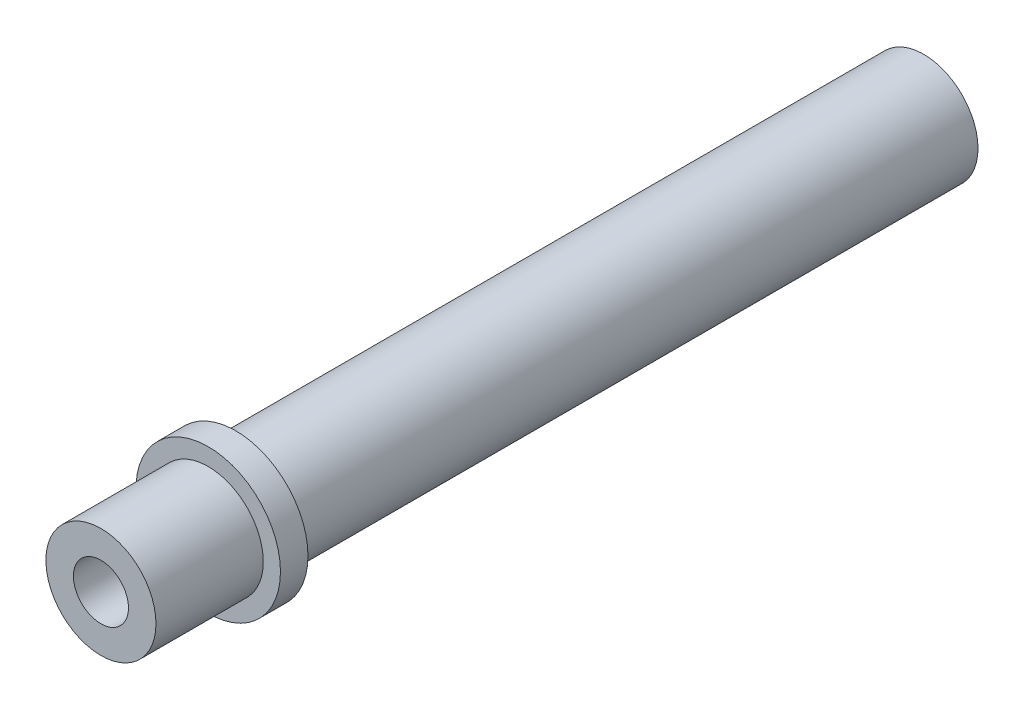
from build123d import *

# Parameters (mm, degrees)
S01_PRINTABLE_SLIDING_PIN_7_90_MM_R            = 3.95
F_01_PRINTABLE_SLIDING_PIN_7_90_MM_DEPTH       = 40
F_02_START                                     = 40
S02_RECESSED_LOAD_SHOULDER_R                   = 5.25
F_02_RECESSED_LOAD_SHOULDER_DEPTH              = 2
F_03_START                                     = 42
S03_LOCATING_PILOT_THROUGH_SWING_ARM_R         = 4
F_03_LOCATING_PILOT_THROUGH_SWING_ARM_DEPTH    = 7.8
F_04_START                                     = 42.6
S04_M3_HEAT_SET_POCKET_IN_SUPPORTED_RO_R       = 2
F_04_M3_HEAT_SET_POCKET_IN_SUPPORTED_ROO_DEPTH = 7.3
F_01_START                                     = -10
S01_EXTENDED_SLIDING_JOURNAL_10_MM_R           = 3.95
F_01_EXTENDED_SLIDING_JOURNAL_10_MM_DEPTH      = 10.05


with BuildPart() as part:
    # S01 - Printable sliding pin - 7.90 mm → 01 - Printable sliding pin - 7.90 mm (new body)
    with BuildSketch(Plane.XY):
        Circle(S01_PRINTABLE_SLIDING_PIN_7_90_MM_R)
    extrude(amount=F_01_PRINTABLE_SLIDING_PIN_7_90_MM_DEPTH)

    # S02 - Recessed load shoulder → 02 - Recessed load shoulder (add)
    with BuildSketch(Plane.XY.offset(F_02_START)):
        Circle(S02_RECESSED_LOAD_SHOULDER_R)
    extrude(amount=F_02_RECESSED_LOAD_SHOULDER_DEPTH)

    # S03 - Locating pilot through swing arm → 03 - Locating pilot through swing arm (add)
    with BuildSketch(Plane.XY.offset(F_03_START)):
        Circle(S03_LOCATING_PILOT_THROUGH_SWING_ARM_R)
    extrude(amount=F_03_LOCATING_PILOT_THROUGH_SWING_ARM_DEPTH)

    # S04 - M3 heat-set pocket in supported root → 04 - M3 heat-set pocket in supported root (cut)
    with BuildSketch(Plane.XY.offset(F_04_START)):
        Circle(S04_M3_HEAT_SET_POCKET_IN_SUPPORTED_RO_R)
    extrude(amount=F_04_M3_HEAT_SET_POCKET_IN_SUPPORTED_ROO_DEPTH, mode=Mode.SUBTRACT)

    # S01 - Extended sliding journal - 10 mm → 01 - Extended sliding journal - 10 mm (add)
    with BuildSketch(Plane.XY.offset(F_01_START)):
        Circle(S01_EXTENDED_SLIDING_JOURNAL_10_MM_R)
    extrude(amount=F_01_EXTENDED_SLIDING_JOURNAL_10_MM_DEPTH)


solid = part.part
